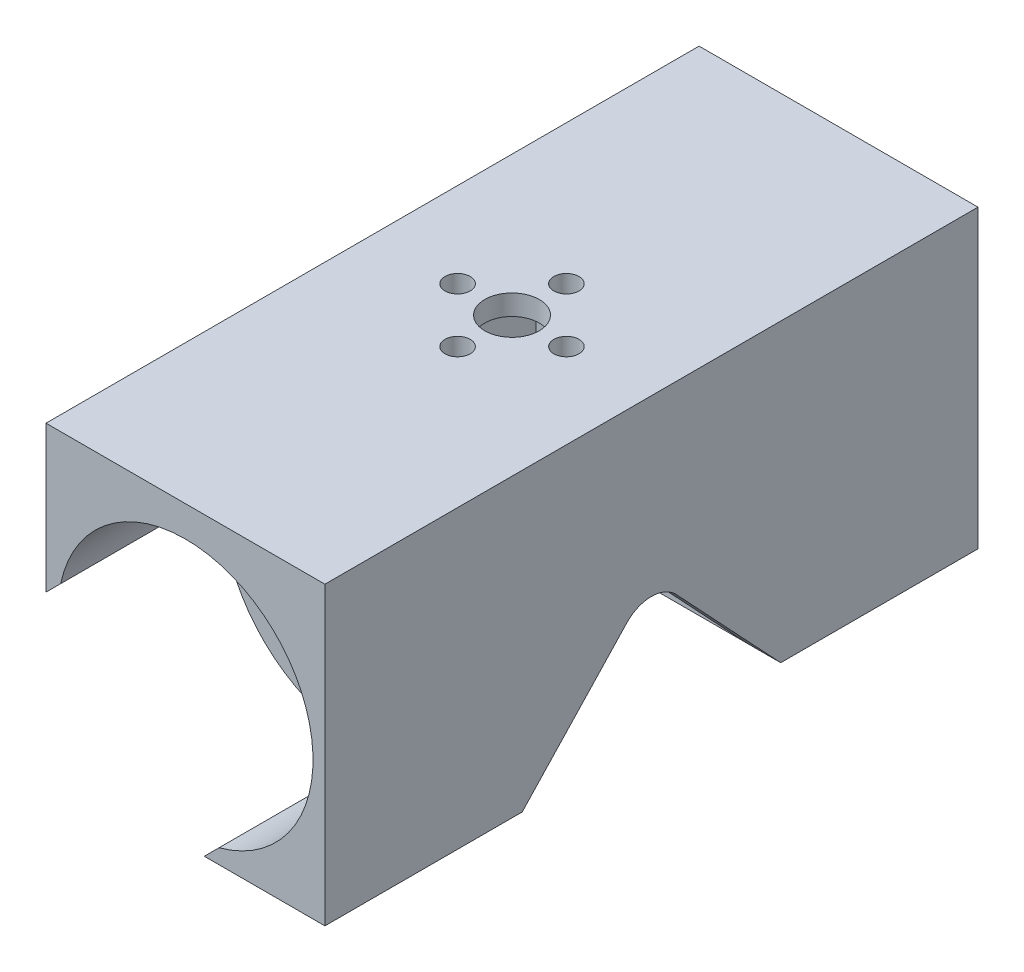
from build123d import *

# Parameters (mm, degrees)
SKETCH1_W               = 41
SKETCH1_H               = 96
SKETCH1_R               = 4
SKETCH1_R_2             = 1.85
BOSS_EXTRUDE1_DEPTH     = 43.5
CUT_EXTRUDE1_DEPTH      = 108.370852656
CUT_EXTRUDE1_DEPTH_BACK = 26
CUT_EXTRUDE2_START      = -96
CUT_EXTRUDE2_DEPTH      = 26
SKETCH4_W               = 41
SKETCH4_H               = 38
CUT_EXTRUDE4_DEPTH      = 40.5
BOSS_EXTRUDE2_START     = 20.5
BOSS_EXTRUDE2_DEPTH     = 5
BOSS_EXTRUDE3_START     = -15.5
BOSS_EXTRUDE3_DEPTH     = 5
CUT_EXTRUDE5_START      = -44
CUT_EXTRUDE5_DEPTH      = 44


# Read off the part's stored shape, not the designer's step: Cut-Extrude5
with BuildPart() as part:
    # Sketch1 → Boss-Extrude1 (new body)
    with BuildSketch(Plane(origin=(0, 0, 0), x_dir=(1, 0, 0), z_dir=(0, 1, 0))):
        Rectangle(SKETCH1_W, SKETCH1_H)
        with Locations(Location((0, 0, 0), (0, 0, 270))):
            Circle(SKETCH1_R, mode=Mode.SUBTRACT)
        with Locations(Location((0, -8, 0), (0, 0, 270))):
            Circle(SKETCH1_R_2, mode=Mode.SUBTRACT)
        with Locations(Location((-8, 0, 0), (0, 0, 270))):
            Circle(SKETCH1_R_2, mode=Mode.SUBTRACT)
        with Locations(Location((0, 8, 0), (0, 0, 270))):
            Circle(SKETCH1_R_2, mode=Mode.SUBTRACT)
        with Locations(Location((8, 0, 0), (0, 0, 270))):
            Circle(SKETCH1_R_2, mode=Mode.SUBTRACT)
    extrude(amount=-BOSS_EXTRUDE1_DEPTH)

    # Sketch3 → Cut-Extrude1 (cut, two sides: drawn at the far end of the back side and taken through both)
    with BuildSketch(Plane.XY.offset(48).offset(-CUT_EXTRUDE1_DEPTH_BACK)):
        with BuildLine():
            Line((-18.340899032, -19.35462804), (-20.5, -21.513729008))
            Line((-20.5, -21.513729008), (-20.5, -43.5))
            Line((-20.5, -43.5), (2.768563004, -43.5))
            Line((2.768563004, -43.5), (4.927663972, -41.340899032))
            ThreePointArc((4.927663972, -41.340899032), (12.877412268, -9.621546189), (-18.340899032, -19.35462804))
        make_face()
    extrude(amount=CUT_EXTRUDE1_DEPTH + CUT_EXTRUDE1_DEPTH_BACK, mode=Mode.SUBTRACT)

    # Sketch3<4> → Cut-Extrude2 (cut)
    with BuildSketch(Plane.XY.offset(48).offset(CUT_EXTRUDE2_START)):
        with BuildLine():
            Line((-18.340899032, -19.35462804), (-20.5, -21.513729008))
            Line((-20.5, -21.513729008), (-20.5, -43.5))
            Line((-20.5, -43.5), (2.768563004, -43.5))
            Line((2.768563004, -43.5), (4.927663972, -41.340899032))
            ThreePointArc((4.927663972, -41.340899032), (12.877412268, -9.621546189), (-18.340899032, -19.35462804))
        make_face()
    extrude(amount=CUT_EXTRUDE2_DEPTH, mode=Mode.SUBTRACT)

    # Sketch4 → Cut-Extrude4 (cut)
    with BuildSketch(Plane.XZ.offset(43.5)):
        Rectangle(SKETCH4_W, SKETCH4_H)
    extrude(amount=-CUT_EXTRUDE4_DEPTH, mode=Mode.SUBTRACT)

    # Sketch5 → Boss-Extrude2 (add)
    with BuildSketch(Plane(origin=(0, 0, 0), x_dir=(0, 0, -1), z_dir=(1, 0, 0)).offset(BOSS_EXTRUDE2_START)):
        with BuildLine():
            Line((-19, -43.5), (-3.646281893, -27.13616886))
            ThreePointArc((-3.646281893, -27.13616886), (0, -25.557371624), (3.646281893, -27.13616886))
            Line((3.646281893, -27.13616886), (19, -43.5))
            Line((19, -43.5), (19, -3))
            Line((19, -3), (-19, -3))
            Line((-19, -3), (-19, -43.5))
        make_face()
    extrude(amount=-BOSS_EXTRUDE2_DEPTH)

    # Sketch5<2> → Boss-Extrude3 (add)
    with BuildSketch(Plane(origin=(0, 0, 0), x_dir=(0, 0, -1), z_dir=(1, 0, 0)).offset(BOSS_EXTRUDE3_START)):
        with BuildLine():
            Line((-19, -43.5), (-3.646281893, -27.13616886))
            ThreePointArc((-3.646281893, -27.13616886), (0, -25.557371624), (3.646281893, -27.13616886))
            Line((3.646281893, -27.13616886), (19, -43.5))
            Line((19, -43.5), (19, -3))
            Line((19, -3), (-19, -3))
            Line((-19, -3), (-19, -43.5))
        make_face()
    extrude(amount=-BOSS_EXTRUDE3_DEPTH)

    # Cut-Extrude5 outline → Cut-Extrude5 (cut)
    with BuildSketch(Plane.XY.offset(22).offset(CUT_EXTRUDE5_START)):
        with BuildLine():
            Line((-20.5, -43.5), (-2.768563004, -43.5))
            ThreePointArc((-2.768563004, -43.5), (-14.946344874, -37.246752593), (-20.5, -24.734423107))
            Line((-20.5, -24.734423107), (-20.5, -43.5))
        make_face()
    extrude(amount=CUT_EXTRUDE5_DEPTH, mode=Mode.SUBTRACT)


solid = part.part
